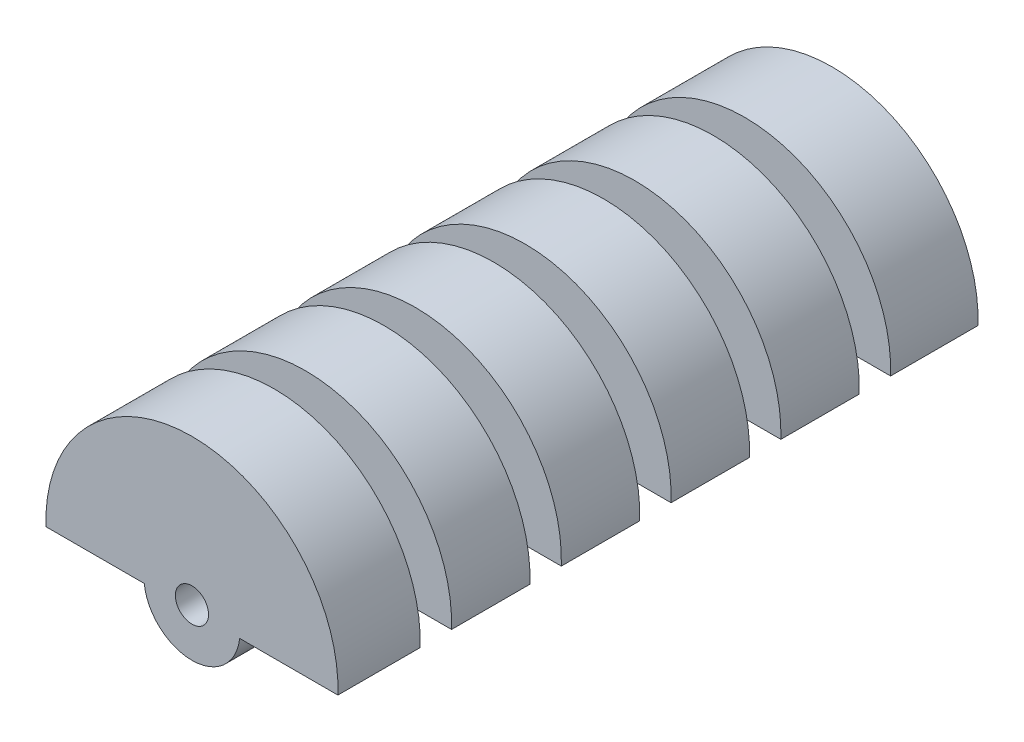
from build123d import *

# Parameters (mm, degrees)
SKETCH3_R            = 27.94
BOSS_EXTRUDE2_DEPTH  = 122.46
SKETCH5_R            = 3.175
CUT_EXTRUDE1_DEPTH   = 129.676877488
SKETCH4_W            = 14
SKETCH4_H            = 6
SHELL1_START         = 3
SHELL1_OUTLINE_R     = 10.94
SHELL1_OUTLINE_R_2   = 6.175
SHELL1_DEPTH         = 116.46
SHELL1_2_OUTLINE_R   = 24.94
SHELL1_2_OUTLINE_R_2 = 10.94
SHELL1_2_DEPTH       = 10.72
SHELL1_START_2       = 109.72
SHELL1_3_OUTLINE_R   = 24.94
SHELL1_3_OUTLINE_R_2 = 10.94
SHELL1_3_DEPTH       = 9.74
SHELL1_START_3       = 25.72
SHELL1_4_OUTLINE_R   = 24.94
SHELL1_4_OUTLINE_R_2 = 10.94
SHELL1_4_DEPTH       = 9
SHELL1_START_4       = 46.72
SHELL1_5_OUTLINE_R   = 24.94
SHELL1_5_OUTLINE_R_2 = 10.94
SHELL1_5_DEPTH       = 9
SHELL1_START_5       = 67.72
SHELL1_6_OUTLINE_R   = 24.94
SHELL1_6_OUTLINE_R_2 = 10.94
SHELL1_6_DEPTH       = 9
SHELL1_START_6       = 88.72
SHELL1_7_OUTLINE_R   = 24.94
SHELL1_7_OUTLINE_R_2 = 10.94
SHELL1_7_DEPTH       = 9
BOSS_EXTRUDE3_REACH  = 130.677
SKETCH13_W           = 16.483162312
SKETCH13_H           = 6
CUT_EXTRUDE3_DEPTH   = 123
BOSS_EXTRUDE5_START  = -122.46
BOSS_EXTRUDE5_DEPTH  = 122.46


# Read off the part's stored shape, not the designer's step: Shell1
with BuildPart() as part:
    # Sketch3 → Boss-Extrude2 (new body)
    with BuildSketch(Plane.XY):
        Circle(SKETCH3_R)
    extrude(amount=BOSS_EXTRUDE2_DEPTH)

    # Sketch5 → Cut-Extrude1 (cut, through all)
    with BuildSketch(Plane.XY.offset(122.46)):
        Circle(SKETCH5_R)
    extrude(amount=-CUT_EXTRUDE1_DEPTH, mode=Mode.SUBTRACT)

    # Sketch4 → Cut-Revolve1 (revolve, cut)
    with BuildSketch(Plane(origin=(0, 0, 0), x_dir=(1, 0, 0), z_dir=(0, 1, 0)), mode=Mode.PRIVATE) as cut_revolve1_sk:
        with Locations((-20.94, -103.72)):
            Rectangle(SKETCH4_W, SKETCH4_H)
        with Locations((-20.94, -82.72)):
            Rectangle(SKETCH4_W, SKETCH4_H)
        with Locations((-20.94, -61.72)):
            Rectangle(SKETCH4_W, SKETCH4_H)
        with Locations((-20.94, -40.72)):
            Rectangle(SKETCH4_W, SKETCH4_H)
        with Locations((-20.94, -19.72)):
            Rectangle(SKETCH4_W, SKETCH4_H)
    revolve(cut_revolve1_sk.sketch.rotate(Axis((0, 0, 122.46), (0, 0, -1)), 180), axis=Axis((0, 0, 122.46), (0, 0, -1)), mode=Mode.SUBTRACT)

    # Shell1 outline → Shell1 (cut)
    with BuildSketch(Plane.XY.offset(SHELL1_START)):
        Circle(SHELL1_OUTLINE_R)
        Circle(SHELL1_OUTLINE_R_2, mode=Mode.SUBTRACT)
    extrude(amount=SHELL1_DEPTH, mode=Mode.SUBTRACT)

    # Shell1 2 outline → Shell1 2 (cut)
    with BuildSketch(Plane.XY.offset(SHELL1_START)):
        Circle(SHELL1_2_OUTLINE_R)
        Circle(SHELL1_2_OUTLINE_R_2, mode=Mode.SUBTRACT)
    extrude(amount=SHELL1_2_DEPTH, mode=Mode.SUBTRACT)

    # Shell1 3 outline → Shell1 3 (cut)
    with BuildSketch(Plane.XY.offset(SHELL1_START_2)):
        Circle(SHELL1_3_OUTLINE_R)
        Circle(SHELL1_3_OUTLINE_R_2, mode=Mode.SUBTRACT)
    extrude(amount=SHELL1_3_DEPTH, mode=Mode.SUBTRACT)

    # Shell1 4 outline → Shell1 4 (cut)
    with BuildSketch(Plane.XY.offset(SHELL1_START_3)):
        Circle(SHELL1_4_OUTLINE_R)
        Circle(SHELL1_4_OUTLINE_R_2, mode=Mode.SUBTRACT)
    extrude(amount=SHELL1_4_DEPTH, mode=Mode.SUBTRACT)

    # Shell1 5 outline → Shell1 5 (cut)
    with BuildSketch(Plane.XY.offset(SHELL1_START_4)):
        Circle(SHELL1_5_OUTLINE_R)
        Circle(SHELL1_5_OUTLINE_R_2, mode=Mode.SUBTRACT)
    extrude(amount=SHELL1_5_DEPTH, mode=Mode.SUBTRACT)

    # Shell1 6 outline → Shell1 6 (cut)
    with BuildSketch(Plane.XY.offset(SHELL1_START_5)):
        Circle(SHELL1_6_OUTLINE_R)
        Circle(SHELL1_6_OUTLINE_R_2, mode=Mode.SUBTRACT)
    extrude(amount=SHELL1_6_DEPTH, mode=Mode.SUBTRACT)

    # Shell1 7 outline → Shell1 7 (cut)
    with BuildSketch(Plane.XY.offset(SHELL1_START_6)):
        Circle(SHELL1_7_OUTLINE_R)
        Circle(SHELL1_7_OUTLINE_R_2, mode=Mode.SUBTRACT)
    extrude(amount=SHELL1_7_DEPTH, mode=Mode.SUBTRACT)

    # Boss-Extrude3: up to this face of the body (flat: up to its plane)
    boss_extrude3_end = Plane(part.part.faces().sort_by_distance((-27.149737461, 0, 122.46))[0])
    # Sketch10 → Boss-Extrude3 (add, up to the picked face)
    with BuildSketch(Plane(origin=(0, 0, 0), x_dir=(-1, 0, 0), z_dir=(0, 0, -1)), mode=Mode.PRIVATE) as boss_extrude3_sk1:
        with BuildLine():
            Line((-1, 27.922098775), (-1, 3.01340754))
            ThreePointArc((-1, 3.01340754), (0, 3.175), (1, 3.01340754))
            Line((1, 3.01340754), (1, 27.922098775))
            ThreePointArc((1, 27.922098775), (0, 27.94), (-1, 27.922098775))
        make_face()
    boss_extrude3_tool1 = split(extrude(boss_extrude3_sk1.sketch, amount=-BOSS_EXTRUDE3_REACH, mode=Mode.PRIVATE), bisect_by=boss_extrude3_end, keep=Keep.BOTH, mode=Mode.PRIVATE)
    # Sketch10 → Boss-Extrude3 (add, up to the picked face)
    with BuildSketch(Plane(origin=(0, 0, 0), x_dir=(-1, 0, 0), z_dir=(0, 0, -1)), mode=Mode.PRIVATE) as boss_extrude3_sk2:
        with BuildLine():
            Line((3.01340754, 1), (27.922098775, 1))
            ThreePointArc((27.922098775, 1), (27.94, 0), (27.922098775, -1))
            Line((27.922098775, -1), (3.01340754, -1))
            ThreePointArc((3.01340754, -1), (3.175, 0), (3.01340754, 1))
        make_face()
    boss_extrude3_tool2 = split(extrude(boss_extrude3_sk2.sketch, amount=-BOSS_EXTRUDE3_REACH, mode=Mode.PRIVATE), bisect_by=boss_extrude3_end, keep=Keep.BOTH, mode=Mode.PRIVATE)
    # Sketch10 → Boss-Extrude3 (add, up to the picked face)
    with BuildSketch(Plane(origin=(0, 0, 0), x_dir=(-1, 0, 0), z_dir=(0, 0, -1)), mode=Mode.PRIVATE) as boss_extrude3_sk3:
        with BuildLine():
            Line((-1, -3.01340754), (-1, -27.922098775))
            ThreePointArc((-1, -27.922098775), (0, -27.94), (1, -27.922098775))
            Line((1, -27.922098775), (1, -3.01340754))
            ThreePointArc((1, -3.01340754), (0, -3.175), (-1, -3.01340754))
        make_face()
    boss_extrude3_tool3 = split(extrude(boss_extrude3_sk3.sketch, amount=-BOSS_EXTRUDE3_REACH, mode=Mode.PRIVATE), bisect_by=boss_extrude3_end, keep=Keep.BOTH, mode=Mode.PRIVATE)
    # Sketch10 → Boss-Extrude3 (add, up to the picked face)
    with BuildSketch(Plane(origin=(0, 0, 0), x_dir=(-1, 0, 0), z_dir=(0, 0, -1)), mode=Mode.PRIVATE) as boss_extrude3_sk4:
        with BuildLine():
            Line((-27.922098775, -1), (-3.01340754, -1))
            ThreePointArc((-3.01340754, -1), (-3.175, 0), (-3.01340754, 1))
            Line((-3.01340754, 1), (-27.922098775, 1))
            ThreePointArc((-27.922098775, 1), (-27.94, 0), (-27.922098775, -1))
        make_face()
    boss_extrude3_tool4 = split(extrude(boss_extrude3_sk4.sketch, amount=-BOSS_EXTRUDE3_REACH, mode=Mode.PRIVATE), bisect_by=boss_extrude3_end, keep=Keep.BOTH, mode=Mode.PRIVATE)
    add(boss_extrude3_tool1.solids().sort_by(Axis((0, 15.527819, 0), (0, 0, 1)))[0])
    add(boss_extrude3_tool2.solids().sort_by(Axis((-15.527819, 0, 0), (0, 0, 1)))[0])
    add(boss_extrude3_tool3.solids().sort_by(Axis((0, -15.527819, 0), (0, 0, 1)))[0])
    add(boss_extrude3_tool4.solids().sort_by(Axis((15.527819, 0, 0), (0, 0, 1)))[0])

    # Sketch13 → Cut-Revolve2 (revolve, cut)
    with BuildSketch(Plane(origin=(0, 0, 0), x_dir=(1, 0, 0), z_dir=(0, 1, 0)), mode=Mode.PRIVATE) as cut_revolve2_sk:
        with Locations((-22.145666886, -40.72)):
            Rectangle(SKETCH13_W, SKETCH13_H)
        with Locations((-22.145666886, -19.72)):
            Rectangle(SKETCH13_W, SKETCH13_H)
        with Locations((-22.145666886, -61.72)):
            Rectangle(SKETCH13_W, SKETCH13_H)
        with Locations((-22.145666886, -82.72)):
            Rectangle(SKETCH13_W, SKETCH13_H)
        with Locations((-22.145666886, -103.72)):
            Rectangle(SKETCH13_W, SKETCH13_H)
    revolve(cut_revolve2_sk.sketch.rotate(Axis((0, 0, 121.588746248), (0, 0, -1)), 180), axis=Axis((0, 0, 121.588746248), (0, 0, -1)), mode=Mode.SUBTRACT)

    # Sketch16 → Cut-Extrude3 (cut)
    with BuildSketch(Plane(origin=(0, 0, 0), x_dir=(-1, 0, 0), z_dir=(0, 0, -1))):
        with BuildLine():
            Line((-27.923120749, -0.971044624), (-6.098171639, -0.971044624))
            ThreePointArc((-6.098171639, -0.971044624), (-0.014665674, -6.174982584), (6.093490379, -1))
            Line((6.093490379, -1), (27.922098775, -1))
            ThreePointArc((27.922098775, -1), (-0.014486703, -27.939996244), (-27.923120749, -0.971044624))
        make_face()
    extrude(amount=-CUT_EXTRUDE3_DEPTH, mode=Mode.SUBTRACT)

    # Sketch18 → Boss-Extrude5 (add)
    with BuildSketch(Plane(origin=(0, 0, 0), x_dir=(-1, 0, 0), z_dir=(0, 0, -1)).offset(BOSS_EXTRUDE5_START)):
        with BuildLine():
            Line((-3.175, 0), (-9.175, 0))
            ThreePointArc((-9.175, 0), (0, -9.175), (9.175, 0))
            Line((9.175, 0), (3.175, 0))
            ThreePointArc((3.175, 0), (0, -3.175), (-3.175, 0))
        make_face()
    extrude(amount=BOSS_EXTRUDE5_DEPTH)


solid = part.part
